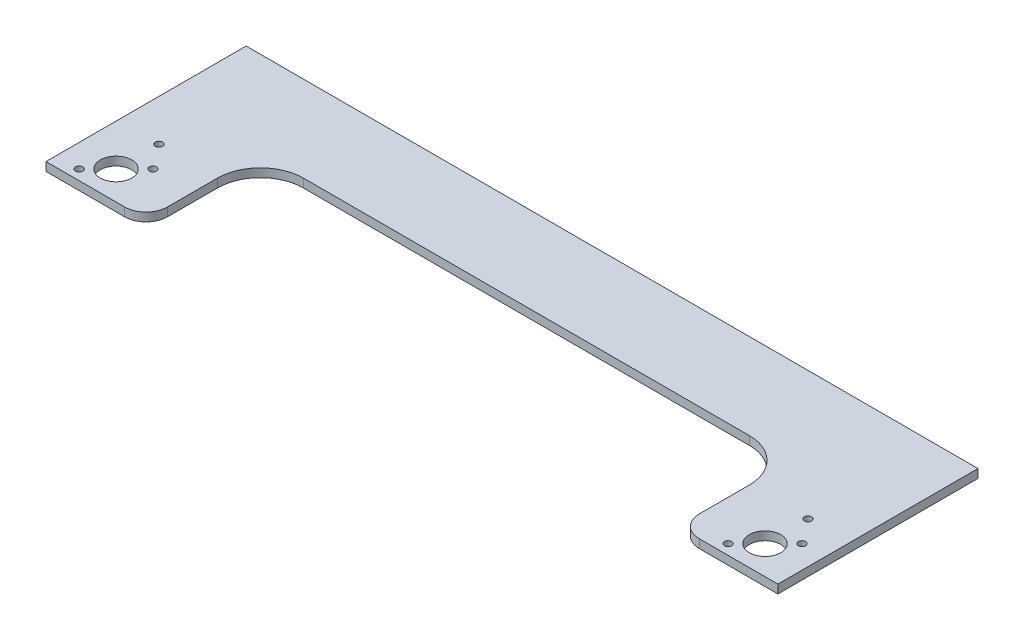
from build123d import *

# Parameters (mm, degrees)
SKETCH_1_R               = 2.55
EXTRUDE_1_DEPTH          = 6
CUT_EXTRUDE_1_DEPTH      = 14
CUT_EXTRUDE_1_DEPTH_BACK = 5
SKETCH_7_R               = 11
SKETCH_7_R_2             = 2.55
CUT_EXTRUDE_2_DEPTH      = 11
CUT_EXTRUDE_2_DEPTH_BACK = 5
SKETCH_8_R               = 11
SKETCH_8_R_2             = 2.55


with BuildPart() as part:
    # Эскиз1 → Бобышка-Вытянуть1 (new body)
    with BuildSketch(Plane(origin=(0, 0, 0), x_dir=(1, 0, 0), z_dir=(0, 1, 0))):
        with BuildLine():
            Line((-322.202898551, -260), (-322.202898551, -120))
            Line((-322.202898551, -120), (189.797101449, -120))
            Line((189.797101449, -120), (189.797101449, -260))
            Line((189.797101449, -260), (134.797101449, -260))
            ThreePointArc((134.797101449, -260), (124.190499731, -255.606601718), (119.797101449, -245))
            Line((119.797101449, -245), (119.797101449, -210))
            ThreePointArc((119.797101449, -210), (111.010304885, -188.786796564), (89.797101449, -180))
            Line((89.797101449, -180), (-222.202898551, -180))
            ThreePointArc((-222.202898551, -180), (-243.416101986, -188.786796564), (-252.202898551, -210))
            Line((-252.202898551, -210), (-252.202898551, -245))
            ThreePointArc((-252.202898551, -245), (-256.596296833, -255.606601718), (-267.202898551, -260))
            Line((-267.202898551, -260), (-322.202898551, -260))
        make_face()
        with Locations((-293.202898551, -210)):
            Circle(SKETCH_1_R, mode=Mode.SUBTRACT)
        with Locations((160.797101449, -210)):
            Circle(SKETCH_1_R, mode=Mode.SUBTRACT)
    extrude(amount=EXTRUDE_1_DEPTH)

    # Эскиз7 → Вырез-Вытянуть1 (cut, two sides: drawn at the far end of the back side and taken through both)
    with BuildSketch(Plane(origin=(0, 0, 0), x_dir=(1, 0, 0), z_dir=(0, 1, 0)).offset(-CUT_EXTRUDE_1_DEPTH_BACK)):
        with Locations((-293.202898551, -240)):
            Circle(SKETCH_7_R)
        with Locations((-280.298199794, -227.095301243)):
            Circle(SKETCH_7_R_2)
        with Locations((-306.107597307, -252.904698757)):
            Circle(SKETCH_7_R_2)
    extrude(amount=CUT_EXTRUDE_1_DEPTH + CUT_EXTRUDE_1_DEPTH_BACK, mode=Mode.SUBTRACT)

    # Эскиз8 → Вырез-Вытянуть2 (cut, two sides: drawn at the far end of the back side and taken through both)
    with BuildSketch(Plane(origin=(0, 0, 0), x_dir=(1, 0, 0), z_dir=(0, 1, 0)).offset(-CUT_EXTRUDE_2_DEPTH_BACK)):
        with Locations((160.797101449, -240)):
            Circle(SKETCH_8_R)
        with Locations((147.892402693, -252.904698757)):
            Circle(SKETCH_8_R_2)
        with Locations((173.701800206, -227.095301244)):
            Circle(SKETCH_8_R_2)
    extrude(amount=CUT_EXTRUDE_2_DEPTH + CUT_EXTRUDE_2_DEPTH_BACK, mode=Mode.SUBTRACT)


solid = part.part
